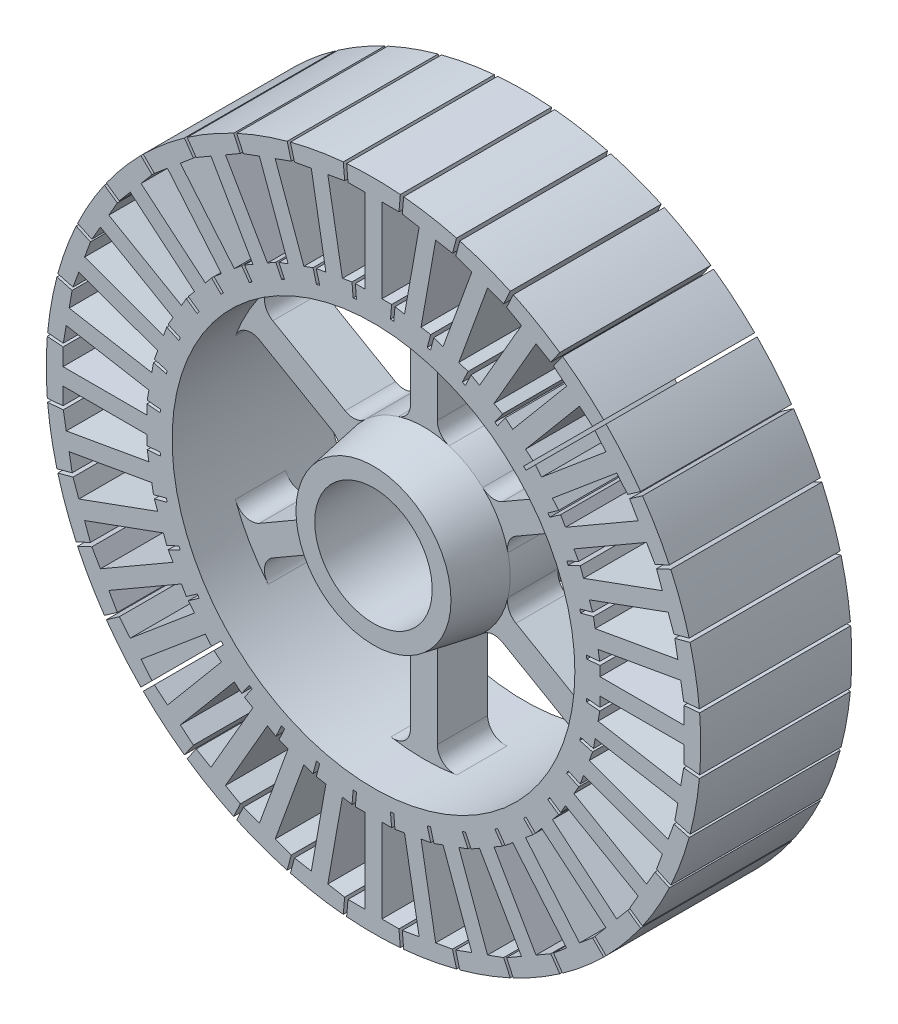
from build123d import *
from build123d.topology import SkipClean

# Parameters (mm, degrees)
SKETCH_1_R          = 97.5
SKETCH_1_R_2        = 17.5
EXTRUDE_1_DEPTH     = 45
CUT_EXTRUDE_1_DEPTH = 146.043097044
SKETCH_3_R          = 60
SKETCH_3_R_2        = 27.5
CUT_EXTRUDE_2_DEPTH = 15
CUT_EXTRUDE_START   = -15
SKETCH_4_R          = 60
SKETCH_4_R_2        = 27.5
CUT_EXTRUDE_3_DEPTH = 15
CHAMFER_1_SIZE      = 25
CHAMFER_1_SIZE_2    = 4.408174518
CUT_EXTRUDE_4_DEPTH = 142.111657917


with BuildPart() as part:
    # Эскиз1 → Бобышка-Вытянуть1 (new body)
    with BuildSketch(Plane.XY):
        with Locations(Location((0, 0, 0), (0, 0, 180))):
            Circle(SKETCH_1_R)
        with Locations(Location((0, 0, 0), (0, 0, 180))):
            Circle(SKETCH_1_R_2, mode=Mode.SUBTRACT)
    extrude(amount=EXTRUDE_1_DEPTH)

    # Эскиз2 → Вырез-Вытянуть1 (cut, through all)
    with BuildSketch(Plane.XY.offset(45)):
        Polygon((-8.051767933, 97.768985228), (-7.590791457, 92.5), (-2.5, 92.5), (-2.5, 67.5), (-5.403574869, 67.5), (-5.05780639, 63.547848192), (-6.054001088, 63.46069245), (-6.399769567, 67.412844257), (-9.25923261, 66.908643772), (-13.600437052, 91.528837598), (-8.586986155, 92.412844257), (-9.047962631, 97.681829485), align=None)
        Polygon((9.047962631, 97.681829485), (8.051767933, 97.768985228), (7.590791457, 92.5), (2.5, 92.5), (2.5, 67.5), (5.403574869, 67.5), (5.05780639, 63.547848192), (6.054001088, 63.46069245), (6.399769567, 67.412844257), (9.25923261, 66.908643772), (13.600437052, 91.528837598), (8.586986155, 92.412844257), align=None)
        Polygon((25.872775429, 94.626660783), (24.906849603, 94.885479828), (23.537926713, 89.77659005), (18.524475817, 90.660596709), (14.183271375, 66.040402884), (17.042734418, 65.536202399), (16.015934979, 61.704134725), (16.981860805, 61.44531568), (18.008660244, 65.277383354), (20.737128123, 64.284302261), (29.287631706, 87.776617781), (24.503852539, 89.517771005), align=None)
        Polygon((41.911457039, 88.696308876), (41.005149252, 89.118927138), (38.769873976, 84.32536384), (33.98609481, 86.066517064), (25.435591226, 62.574201545), (28.164059105, 61.581120452), (26.487427488, 57.985572347), (27.393735275, 57.562954085), (29.070366892, 61.15850219), (31.584936491, 59.706714755), (44.084936491, 81.35734985), (39.676181763, 83.902745579), align=None)
        Polygon((56.676680234, 80.070964507), (55.85752819, 80.644540943), (52.823818237, 76.311954121), (48.415063509, 78.85734985), (35.915063509, 57.206714755), (38.429633108, 55.754927321), (36.154112917, 52.505147696), (36.973264961, 51.931571259), (39.248785152, 55.181350884), (41.473052546, 53.314968935), (57.542742788, 72.466080013), (53.642970281, 75.738377685), align=None)
        Polygon((69.71981118, 69.012704399), (69.012704399, 69.71981118), (65.272737511, 65.979844292), (61.372965004, 69.252141964), (45.303274762, 50.101030886), (47.527542155, 48.234648937), (44.722273919, 45.429380701), (45.429380701, 44.722273919), (48.234648937, 47.527542155), (50.101030886, 45.303274762), (69.252141964, 61.372965004), (65.979844292, 65.272737511), align=None)
        Polygon((80.644540943, 55.857528189), (80.070964507, 56.676680234), (75.738377685, 53.642970281), (72.466080013, 57.542742788), (53.314968935, 41.473052546), (55.181350884, 39.248785152), (51.931571259, 36.973264961), (52.505147696, 36.154112917), (55.754927321, 38.429633108), (57.206714755, 35.915063509), (78.85734985, 48.415063509), (76.311954121, 52.823818237), align=None)
        Polygon((89.118927138, 41.005149252), (88.696308876, 41.911457039), (83.902745579, 39.676181763), (81.35734985, 44.084936491), (59.706714755, 31.584936491), (61.15850219, 29.070366892), (57.562954085, 27.393735275), (57.985572347, 26.487427488), (61.581120452, 28.164059105), (62.574201545, 25.435591226), (86.066517064, 33.98609481), (84.32536384, 38.769873976), align=None)
        Polygon((94.885479828, 24.906849603), (94.626660783, 25.872775429), (89.517771005, 24.503852539), (87.776617781, 29.287631706), (64.284302261, 20.737128123), (65.277383354, 18.008660244), (61.44531568, 16.981860805), (61.704134725, 16.015934979), (65.536202399, 17.042734418), (66.040402884, 14.183271375), (90.660596709, 18.524475817), (89.77659005, 23.537926713), align=None)
        Polygon((97.768985228, 8.051767933), (97.681829485, 9.047962631), (92.412844257, 8.586986155), (91.528837598, 13.600437052), (66.908643772, 9.25923261), (67.412844257, 6.399769567), (63.46069245, 6.054001088), (63.547848192, 5.05780639), (67.5, 5.403574869), (67.5, 2.5), (92.5, 2.5), (92.5, 7.590791457), align=None)
        Polygon((97.681829485, -9.047962631), (97.768985228, -8.051767933), (92.5, -7.590791457), (92.5, -2.5), (67.5, -2.5), (67.5, -5.403574869), (63.547848192, -5.05780639), (63.46069245, -6.054001088), (67.412844257, -6.399769567), (66.908643772, -9.25923261), (91.528837598, -13.600437052), (92.412844257, -8.586986155), align=None)
        Polygon((94.626660783, -25.872775429), (94.885479828, -24.906849603), (89.77659005, -23.537926713), (90.660596709, -18.524475817), (66.040402884, -14.183271375), (65.536202399, -17.042734418), (61.704134725, -16.015934979), (61.44531568, -16.981860805), (65.277383354, -18.008660244), (64.284302261, -20.737128123), (87.776617781, -29.287631706), (89.517771005, -24.503852539), align=None)
        Polygon((88.696308876, -41.911457039), (89.118927138, -41.005149252), (84.32536384, -38.769873976), (86.066517064, -33.98609481), (62.574201545, -25.435591226), (61.581120452, -28.164059105), (57.985572347, -26.487427488), (57.562954085, -27.393735275), (61.15850219, -29.070366892), (59.706714755, -31.584936491), (81.35734985, -44.084936491), (83.902745579, -39.676181763), align=None)
        Polygon((80.070964507, -56.676680234), (80.644540943, -55.85752819), (76.311954121, -52.823818237), (78.85734985, -48.415063509), (57.206714755, -35.915063509), (55.754927321, -38.429633108), (52.505147696, -36.154112917), (51.931571259, -36.973264961), (55.181350884, -39.248785152), (53.314968935, -41.473052546), (72.466080013, -57.542742788), (75.738377685, -53.642970281), align=None)
        Polygon((69.012704399, -69.71981118), (69.71981118, -69.012704399), (65.979844292, -65.272737511), (69.252141964, -61.372965004), (50.101030886, -45.303274762), (48.234648937, -47.527542155), (45.429380701, -44.722273919), (44.722273919, -45.429380701), (47.527542155, -48.234648937), (45.303274762, -50.101030886), (61.372965004, -69.252141964), (65.272737511, -65.979844292), align=None)
        Polygon((55.857528189, -80.644540943), (56.676680234, -80.070964507), (53.642970281, -75.738377685), (57.542742788, -72.466080013), (41.473052546, -53.314968935), (39.248785152, -55.181350884), (36.973264961, -51.931571259), (36.154112917, -52.505147696), (38.429633108, -55.754927321), (35.915063509, -57.206714755), (48.415063509, -78.85734985), (52.823818237, -76.311954121), align=None)
        Polygon((41.005149252, -89.118927138), (41.911457039, -88.696308876), (39.676181763, -83.902745579), (44.084936491, -81.35734985), (31.584936491, -59.706714755), (29.070366892, -61.15850219), (27.393735275, -57.562954085), (26.487427488, -57.985572347), (28.164059105, -61.581120452), (25.435591226, -62.574201545), (33.98609481, -86.066517064), (38.769873976, -84.32536384), align=None)
        Polygon((24.906849603, -94.885479828), (25.872775429, -94.626660783), (24.503852539, -89.517771005), (29.287631706, -87.776617781), (20.737128123, -64.284302261), (18.008660244, -65.277383354), (16.981860805, -61.44531568), (16.015934979, -61.704134725), (17.042734418, -65.536202399), (14.183271375, -66.040402884), (18.524475817, -90.660596709), (23.537926713, -89.77659005), align=None)
        Polygon((8.051767933, -97.768985228), (9.047962631, -97.681829485), (8.586986155, -92.412844257), (13.600437052, -91.528837598), (9.25923261, -66.908643772), (6.399769567, -67.412844257), (6.054001088, -63.46069245), (5.05780639, -63.547848192), (5.403574869, -67.5), (2.5, -67.5), (2.5, -92.5), (7.590791457, -92.5), align=None)
        Polygon((-9.047962631, -97.681829485), (-8.051767933, -97.768985228), (-7.590791457, -92.5), (-2.5, -92.5), (-2.5, -67.5), (-5.403574869, -67.5), (-5.05780639, -63.547848192), (-6.054001088, -63.46069245), (-6.399769567, -67.412844257), (-9.25923261, -66.908643772), (-13.600437052, -91.528837598), (-8.586986155, -92.412844257), align=None)
        Polygon((-25.872775429, -94.626660783), (-24.906849603, -94.885479828), (-23.537926713, -89.77659005), (-18.524475817, -90.660596709), (-14.183271375, -66.040402884), (-17.042734418, -65.536202399), (-16.015934979, -61.704134725), (-16.981860805, -61.44531568), (-18.008660244, -65.277383354), (-20.737128123, -64.284302261), (-29.287631706, -87.776617781), (-24.503852539, -89.517771005), align=None)
        Polygon((-41.911457039, -88.696308876), (-41.005149252, -89.118927138), (-38.769873976, -84.32536384), (-33.98609481, -86.066517064), (-25.435591226, -62.574201545), (-28.164059105, -61.581120452), (-26.487427488, -57.985572347), (-27.393735275, -57.562954085), (-29.070366892, -61.15850219), (-31.584936491, -59.706714755), (-44.084936491, -81.35734985), (-39.676181763, -83.902745579), align=None)
        Polygon((-56.676680234, -80.070964507), (-55.85752819, -80.644540943), (-52.823818237, -76.311954121), (-48.415063509, -78.85734985), (-35.915063509, -57.206714755), (-38.429633108, -55.754927321), (-36.154112917, -52.505147696), (-36.973264961, -51.931571259), (-39.248785152, -55.181350884), (-41.473052546, -53.314968935), (-57.542742788, -72.466080013), (-53.642970281, -75.738377685), align=None)
        Polygon((-69.71981118, -69.012704399), (-69.012704399, -69.71981118), (-65.272737511, -65.979844292), (-61.372965004, -69.252141964), (-45.303274762, -50.101030886), (-47.527542155, -48.234648937), (-44.722273919, -45.429380701), (-45.429380701, -44.722273919), (-48.234648937, -47.527542155), (-50.101030886, -45.303274762), (-69.252141964, -61.372965004), (-65.979844292, -65.272737511), align=None)
        Polygon((-80.644540943, -55.857528189), (-80.070964507, -56.676680234), (-75.738377685, -53.642970281), (-72.466080013, -57.542742788), (-53.314968935, -41.473052546), (-55.181350884, -39.248785152), (-51.931571259, -36.973264961), (-52.505147696, -36.154112917), (-55.754927321, -38.429633108), (-57.206714755, -35.915063509), (-78.85734985, -48.415063509), (-76.311954121, -52.823818237), align=None)
        Polygon((-89.118927138, -41.005149252), (-88.696308876, -41.911457039), (-83.902745579, -39.676181763), (-81.35734985, -44.084936491), (-59.706714755, -31.584936491), (-61.15850219, -29.070366892), (-57.562954085, -27.393735275), (-57.985572347, -26.487427488), (-61.581120452, -28.164059105), (-62.574201545, -25.435591226), (-86.066517064, -33.98609481), (-84.32536384, -38.769873976), align=None)
        Polygon((-94.885479828, -24.906849603), (-94.626660783, -25.872775429), (-89.517771005, -24.503852539), (-87.776617781, -29.287631706), (-64.284302261, -20.737128123), (-65.277383354, -18.008660244), (-61.44531568, -16.981860805), (-61.704134725, -16.015934979), (-65.536202399, -17.042734418), (-66.040402884, -14.183271375), (-90.660596709, -18.524475817), (-89.77659005, -23.537926713), align=None)
        Polygon((-97.768985228, -8.051767933), (-97.681829485, -9.047962631), (-92.412844257, -8.586986155), (-91.528837598, -13.600437052), (-66.908643772, -9.25923261), (-67.412844257, -6.399769567), (-63.46069245, -6.054001088), (-63.547848192, -5.05780639), (-67.5, -5.403574869), (-67.5, -2.5), (-92.5, -2.5), (-92.5, -7.590791457), align=None)
        Polygon((-97.681829485, 9.047962631), (-97.768985228, 8.051767933), (-92.5, 7.590791457), (-92.5, 2.5), (-67.5, 2.5), (-67.5, 5.403574869), (-63.547848192, 5.05780639), (-63.46069245, 6.054001088), (-67.412844257, 6.399769567), (-66.908643772, 9.25923261), (-91.528837598, 13.600437052), (-92.412844257, 8.586986155), align=None)
        Polygon((-94.626660783, 25.872775429), (-94.885479828, 24.906849603), (-89.77659005, 23.537926713), (-90.660596709, 18.524475817), (-66.040402884, 14.183271375), (-65.536202399, 17.042734418), (-61.704134725, 16.015934979), (-61.44531568, 16.981860805), (-65.277383354, 18.008660244), (-64.284302261, 20.737128123), (-87.776617781, 29.287631706), (-89.517771005, 24.503852539), align=None)
        Polygon((-88.696308876, 41.911457039), (-89.118927138, 41.005149252), (-84.32536384, 38.769873976), (-86.066517064, 33.98609481), (-62.574201545, 25.435591226), (-61.581120452, 28.164059105), (-57.985572347, 26.487427488), (-57.562954085, 27.393735275), (-61.15850219, 29.070366892), (-59.706714755, 31.584936491), (-81.35734985, 44.084936491), (-83.902745579, 39.676181763), align=None)
        Polygon((-80.070964507, 56.676680234), (-80.644540943, 55.85752819), (-76.311954121, 52.823818237), (-78.85734985, 48.415063509), (-57.206714755, 35.915063509), (-55.754927321, 38.429633108), (-52.505147696, 36.154112917), (-51.931571259, 36.973264961), (-55.181350884, 39.248785152), (-53.314968935, 41.473052546), (-72.466080013, 57.542742788), (-75.738377685, 53.642970281), align=None)
        Polygon((-69.012704399, 69.71981118), (-69.71981118, 69.012704399), (-65.979844292, 65.272737511), (-69.252141964, 61.372965004), (-50.101030886, 45.303274762), (-48.234648937, 47.527542155), (-45.429380701, 44.722273919), (-44.722273919, 45.429380701), (-47.527542155, 48.234648937), (-45.303274762, 50.101030886), (-61.372965004, 69.252141964), (-65.272737511, 65.979844292), align=None)
        Polygon((-55.857528189, 80.644540943), (-56.676680234, 80.070964507), (-53.642970281, 75.738377685), (-57.542742788, 72.466080013), (-41.473052546, 53.314968935), (-39.248785152, 55.181350884), (-36.973264961, 51.931571259), (-36.154112917, 52.505147696), (-38.429633108, 55.754927321), (-35.915063509, 57.206714755), (-48.415063509, 78.85734985), (-52.823818237, 76.311954121), align=None)
        Polygon((-41.005149252, 89.118927138), (-41.911457039, 88.696308876), (-39.676181763, 83.902745579), (-44.084936491, 81.35734985), (-31.584936491, 59.706714755), (-29.070366892, 61.15850219), (-27.393735275, 57.562954085), (-26.487427488, 57.985572347), (-28.164059105, 61.581120452), (-25.435591226, 62.574201545), (-33.98609481, 86.066517064), (-38.769873976, 84.32536384), align=None)
        Polygon((-24.906849603, 94.885479828), (-25.872775429, 94.626660783), (-24.503852539, 89.517771005), (-29.287631706, 87.776617781), (-20.737128123, 64.284302261), (-18.008660244, 65.277383354), (-16.981860805, 61.44531568), (-16.015934979, 61.704134725), (-17.042734418, 65.536202399), (-14.183271375, 66.040402884), (-18.524475817, 90.660596709), (-23.537926713, 89.77659005), align=None)
    extrude(amount=-CUT_EXTRUDE_1_DEPTH, mode=Mode.SUBTRACT)

    # Эскиз3 → Вырез-Вытянуть2 (cut)
    with BuildSketch(Plane.XY.offset(45)):
        Circle(SKETCH_3_R)
        Circle(SKETCH_3_R_2, mode=Mode.SUBTRACT)
    extrude(amount=-CUT_EXTRUDE_2_DEPTH, mode=Mode.SUBTRACT)

    # Эскиз4 → Вырез-Вытянуть3 (cut)
    with BuildSketch(Plane(origin=(0, 0, 0), x_dir=(-1, 0, 0), z_dir=(0, 0, -1)).offset(CUT_EXTRUDE_START)):
        with Locations(Location((0, 0, 0), (0, 0, 180))):
            Circle(SKETCH_4_R)
        with Locations(Location((0, 0, 0), (0, 0, 180))):
            Circle(SKETCH_4_R_2, mode=Mode.SUBTRACT)
    extrude(amount=CUT_EXTRUDE_3_DEPTH, mode=Mode.SUBTRACT)

    # Фаска1
    # the kernel refuses this chamfer: 25, 4.408174518 mm, written as the material it takes off along each edge
    with BuildSketch(Plane(origin=(0, 0, 0), x_dir=(1, 0, 0), z_dir=(0, 1, 0))) as chamfer_1_piece_1_section:
        Polygon((27.5, -CHAMFER_1_SIZE), (27.5 - CHAMFER_1_SIZE_2, 0), (27.5, 0), align=None)
    chamfer_1_piece_1 = revolve(axis=Axis((0, 0, 0), (0, 0, -1)), mode=Mode.PRIVATE)
    chamfer_1_piece_1 = split(chamfer_1_piece_1, bisect_by=Plane(origin=(-24.534383608, 0, 15), z_dir=(0, 0, -1)), keep=Keep.TOP, mode=Mode.PRIVATE)
    add(chamfer_1_piece_1, mode=Mode.SUBTRACT)
    with BuildSketch(Plane(origin=(0, 0, 45), x_dir=(1, 0, 0), z_dir=(0, -1, 0))) as chamfer_1_piece_2_section:
        Polygon((27.5, -CHAMFER_1_SIZE), (27.5 - CHAMFER_1_SIZE_2, 0), (27.5, 0), align=None)
    chamfer_1_piece_2 = revolve(axis=Axis((0, 0, 45), (0, 0, 1)), mode=Mode.PRIVATE)
    chamfer_1_piece_2 = split(chamfer_1_piece_2, bisect_by=Plane(origin=(-24.534383608, 0, 30), z_dir=(0, 0, 1)), keep=Keep.TOP, mode=Mode.PRIVATE)
    add(chamfer_1_piece_2, mode=Mode.SUBTRACT)

    # Эскиз6 → Вырез-Вытянуть4 (cut, through all)
    with SkipClean():  # the faces are left unmerged after this step: merging them gives an invalid solid
        with BuildSketch(Plane.XY.offset(30)):
            with BuildLine():
                Line((4, 29.389565886), (4, 54.258639865))
                ThreePointArc((4, 54.258639865), (5.766651047, 58.072490222), (9.818181818, 59.191243489))
                ThreePointArc((9.818181818, 59.191243489), (30, 51.961524227), (46.352029634, 38.098416618))
                ThreePointArc((46.352029634, 38.098416618), (47.40892627, 34.030311412), (44.989360498, 30.593421548))
                Line((44.989360498, 30.593421548), (23.452110663, 18.158884558))
                ThreePointArc((23.452110663, 18.158884558), (20.387231271, 17.521022922), (17.543792581, 18.830683018))
                ThreePointArc((17.543792581, 18.830683018), (12.868365096, 22.288662157), (7.535953574, 24.608711562))
                ThreePointArc((7.535953574, 24.608711562), (4.980035315, 26.416371655), (4, 29.389565886))
            make_face()
            with BuildLine():
                Line((27.452110663, -11.230681328), (48.989360498, -23.665218317))
                ThreePointArc((48.989360498, -23.665218317), (53.175577317, -24.04217881), (56.170211452, -21.092826871))
                ThreePointArc((56.170211452, -21.092826871), (60, 0), (56.170211452, 21.092826871))
                ThreePointArc((56.170211452, 21.092826871), (53.175577317, 24.04217881), (48.989360498, 23.665218317))
                Line((48.989360498, 23.665218317), (27.452110663, 11.230681328))
                ThreePointArc((27.452110663, 11.230681328), (25.367266587, 8.895348733), (25.079746154, 5.778028545))
                ThreePointArc((25.079746154, 5.778028545), (25.736730193, 0), (25.079746154, -5.778028545))
                ThreePointArc((25.079746154, -5.778028545), (25.367266587, -8.895348733), (27.452110663, -11.230681328))
            make_face()
            with BuildLine():
                Line((4, -29.389565886), (4, -54.258639865))
                ThreePointArc((4, -54.258639865), (5.766651047, -58.072490222), (9.818181818, -59.191243489))
                ThreePointArc((9.818181818, -59.191243489), (30, -51.961524227), (46.352029634, -38.098416618))
                ThreePointArc((46.352029634, -38.098416618), (47.40892627, -34.030311412), (44.989360498, -30.593421548))
                Line((44.989360498, -30.593421548), (23.452110663, -18.158884558))
                ThreePointArc((23.452110663, -18.158884558), (20.387231271, -17.521022922), (17.543792581, -18.830683018))
                ThreePointArc((17.543792581, -18.830683018), (12.868365096, -22.288662157), (7.535953574, -24.608711562))
                ThreePointArc((7.535953574, -24.608711562), (4.980035315, -26.416371655), (4, -29.389565886))
            make_face()
            with BuildLine():
                Line((-23.452110663, -18.158884558), (-44.989360498, -30.593421548))
                ThreePointArc((-44.989360498, -30.593421548), (-47.40892627, -34.030311412), (-46.352029634, -38.098416618))
                ThreePointArc((-46.352029634, -38.098416618), (-30, -51.961524227), (-9.818181818, -59.191243489))
                ThreePointArc((-9.818181818, -59.191243489), (-5.766651047, -58.072490222), (-4, -54.258639865))
                Line((-4, -54.258639865), (-4, -29.389565886))
                ThreePointArc((-4, -29.389565886), (-4.980035315, -26.416371655), (-7.535953574, -24.608711562))
                ThreePointArc((-7.535953574, -24.608711562), (-12.868365096, -22.288662157), (-17.543792581, -18.830683018))
                ThreePointArc((-17.543792581, -18.830683018), (-20.387231271, -17.521022922), (-23.452110663, -18.158884558))
            make_face()
            with BuildLine():
                Line((-27.452110663, 11.230681328), (-48.989360498, 23.665218317))
                ThreePointArc((-48.989360498, 23.665218317), (-53.175577317, 24.04217881), (-56.170211452, 21.092826871))
                ThreePointArc((-56.170211452, 21.092826871), (-60, 0), (-56.170211452, -21.092826871))
                ThreePointArc((-56.170211452, -21.092826871), (-53.175577317, -24.04217881), (-48.989360498, -23.665218317))
                Line((-48.989360498, -23.665218317), (-27.452110663, -11.230681328))
                ThreePointArc((-27.452110663, -11.230681328), (-25.367266587, -8.895348733), (-25.079746154, -5.778028545))
                ThreePointArc((-25.079746154, -5.778028545), (-25.736730193, 0), (-25.079746154, 5.778028545))
                ThreePointArc((-25.079746154, 5.778028545), (-25.367266587, 8.895348733), (-27.452110663, 11.230681328))
            make_face()
            with BuildLine():
                Line((-4, 29.389565886), (-4, 54.258639865))
                ThreePointArc((-4, 54.258639865), (-5.766651047, 58.072490222), (-9.818181818, 59.191243489))
                ThreePointArc((-9.818181818, 59.191243489), (-30, 51.961524227), (-46.352029634, 38.098416618))
                ThreePointArc((-46.352029634, 38.098416618), (-47.40892627, 34.030311412), (-44.989360498, 30.593421548))
                Line((-44.989360498, 30.593421548), (-23.452110663, 18.158884558))
                ThreePointArc((-23.452110663, 18.158884558), (-20.387231271, 17.521022922), (-17.543792581, 18.830683018))
                ThreePointArc((-17.543792581, 18.830683018), (-12.868365096, 22.288662157), (-7.535953574, 24.608711562))
                ThreePointArc((-7.535953574, 24.608711562), (-4.980035315, 26.416371655), (-4, 29.389565886))
            make_face()
        extrude(amount=-CUT_EXTRUDE_4_DEPTH, mode=Mode.SUBTRACT)
    add(part.part.scale(1), mode=Mode.REPLACE)  # the faces are merged on a copy


solid = part.part
